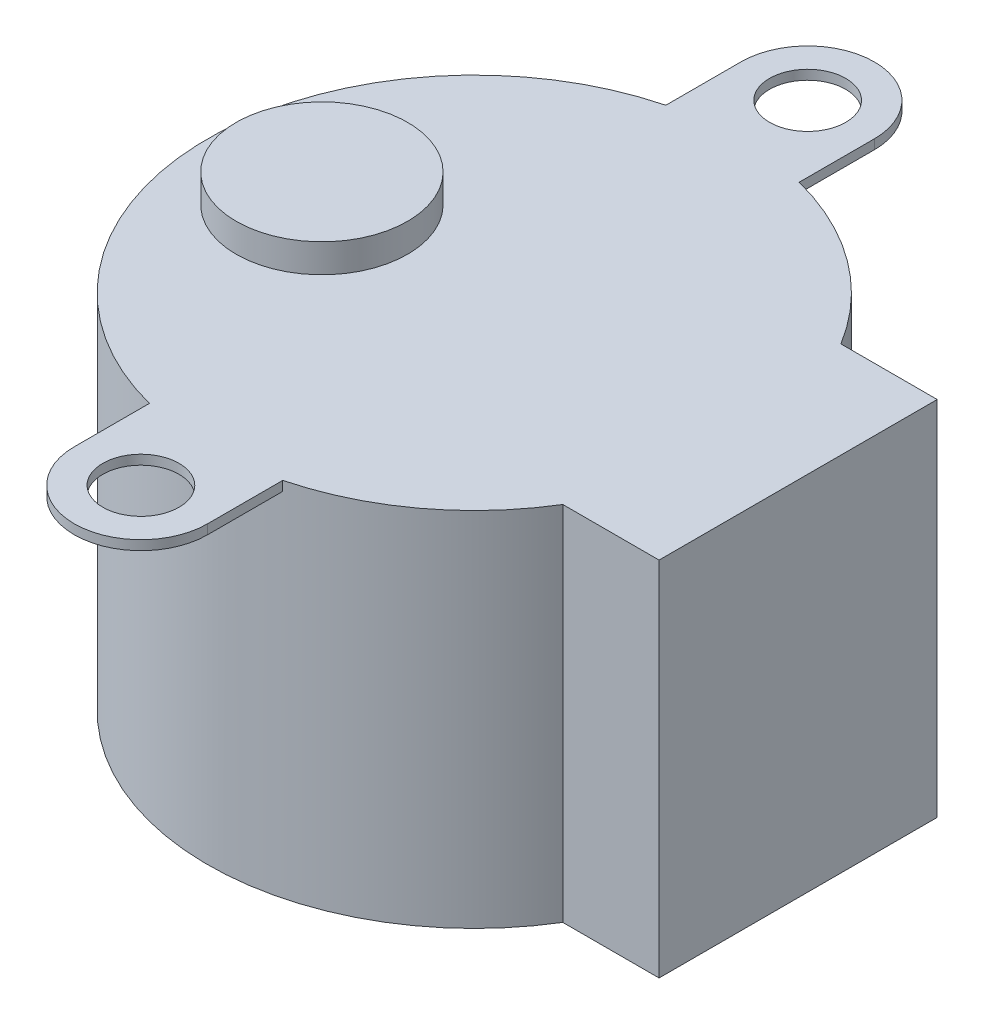
from build123d import *

# Parameters (mm, degrees)
BOSS_EXTRUDE1_DEPTH = 19
SKETCH3_R           = 2
BOSS_EXTRUDE2_DEPTH = 0.5
SKETCH4_R           = 4.5
BOSS_EXTRUDE3_DEPTH = 1.5


with BuildPart() as part:
    # Sketch1 → Boss-Extrude1 (new body)
    with BuildSketch(Plane(origin=(0, 0, 0), x_dir=(1, 0, 0), z_dir=(0, 1, 0))):
        with BuildLine():
            Line((11.94612908, 7.3), (17, 7.3))
            Line((17, 7.3), (17, -7.3))
            Line((17, -7.3), (11.94612908, -7.3))
            ThreePointArc((11.94612908, -7.3), (-14, 0), (11.94612908, 7.3))
        make_face()
    extrude(amount=BOSS_EXTRUDE1_DEPTH)

    # Sketch3 → Boss-Extrude2 (add)
    with BuildSketch(Plane(origin=(0, 19, 0), x_dir=(1, 0, 0), z_dir=(0, 1, 0))):
        with BuildLine():
            Line((3.5, 17.5), (3.5, -17.5))
            ThreePointArc((3.5, -17.5), (0, -21), (-3.5, -17.5))
            Line((-3.5, -17.5), (-3.5, 17.5))
            ThreePointArc((-3.5, 17.5), (0, 21), (3.5, 17.5))
        make_face()
        with Locations((0, -17.5)):
            Circle(SKETCH3_R, mode=Mode.SUBTRACT)
        with Locations((0, 17.5)):
            Circle(SKETCH3_R, mode=Mode.SUBTRACT)
    extrude(amount=-BOSS_EXTRUDE2_DEPTH)

    # Sketch4 → Boss-Extrude3 (add)
    with BuildSketch(Plane(origin=(0, 19, 0), x_dir=(1, 0, 0), z_dir=(0, 1, 0))):
        with Locations((-8, 0)):
            Circle(SKETCH4_R)
    extrude(amount=BOSS_EXTRUDE3_DEPTH)


solid = part.part
